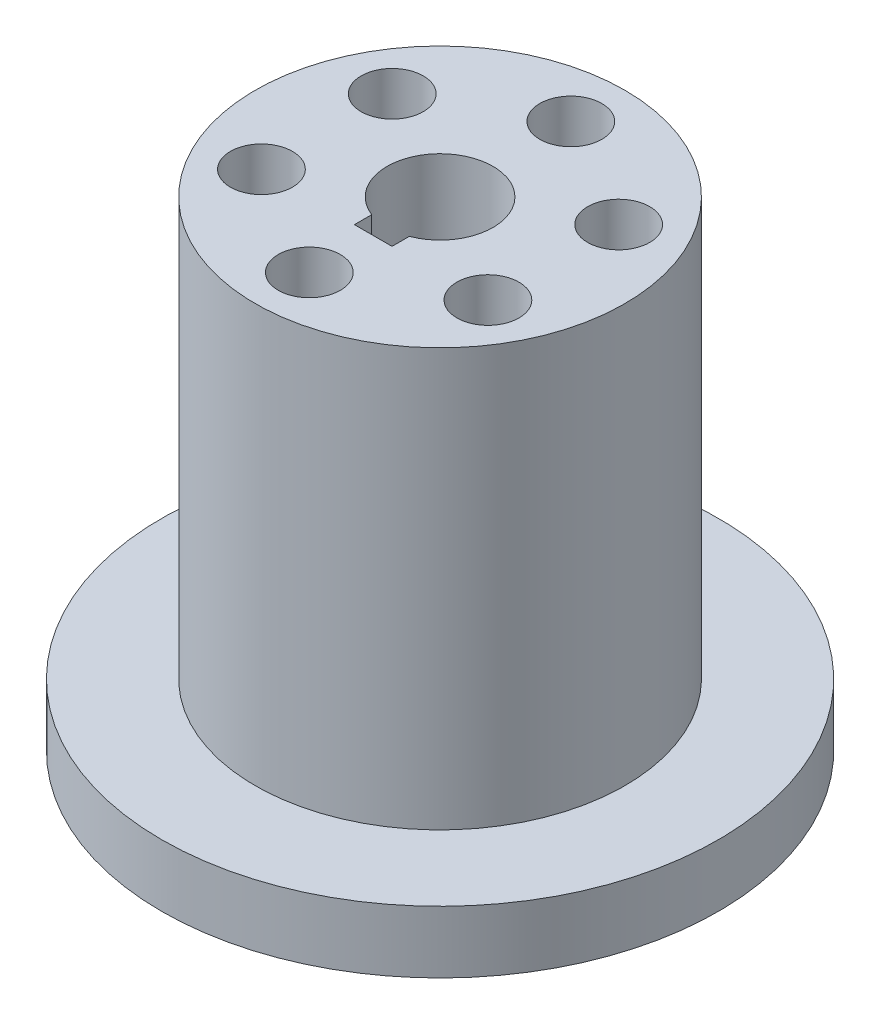
from build123d import *

# Parameters (mm, degrees)
SKETCH1_R           = 38.1
BOSS_EXTRUDE1_DEPTH = 8.5
SKETCH2_R           = 25.3
BOSS_EXTRUDE2_DEPTH = 57.15
SKETCH3_R           = 4.25
CUT_EXTRUDE1_DEPTH  = 78.54
SKETCH4_R           = 6.75
CUT_EXTRUDE2_DEPTH  = 8
CUT_EXTRUDE3_DEPTH  = 91


with BuildPart() as part:
    # Sketch1 → Boss-Extrude1 (new body)
    with BuildSketch(Plane(origin=(0, 0, 0), x_dir=(1, 0, 0), z_dir=(0, 1, 0))):
        Circle(SKETCH1_R)
    extrude(amount=BOSS_EXTRUDE1_DEPTH)

    # Sketch2 → Boss-Extrude2 (add)
    with BuildSketch(Plane(origin=(0, 8.5, 0), x_dir=(1, 0, 0), z_dir=(0, 1, 0))):
        Circle(SKETCH2_R)
    extrude(amount=BOSS_EXTRUDE2_DEPTH)

    # Sketch3 → Cut-Extrude1 (cut)
    with BuildSketch(Plane(origin=(0, 65.65, 0), x_dir=(1, 0, 0), z_dir=(0, 1, 0))):
        with Locations((0, 17.897858345)):
            Circle(SKETCH3_R)
        with Locations((-15.5, 8.948929172)):
            Circle(SKETCH3_R)
        with Locations((15.5, 8.948929172)):
            Circle(SKETCH3_R)
        with Locations((-15.5, -8.948929172)):
            Circle(SKETCH3_R)
        with Locations((15.5, -8.948929172)):
            Circle(SKETCH3_R)
        with Locations((0, -17.897858345)):
            Circle(SKETCH3_R)
    extrude(amount=-CUT_EXTRUDE1_DEPTH, mode=Mode.SUBTRACT)

    # Sketch4 → Cut-Extrude2 (cut)
    with BuildSketch(Plane.XZ):
        with Locations((-15.5, 8.948929172)):
            Circle(SKETCH4_R)
        with Locations((0, 17.897858345)):
            Circle(SKETCH4_R)
        with Locations((15.5, 8.948929172)):
            Circle(SKETCH4_R)
        with Locations((15.5, -8.948929172)):
            Circle(SKETCH4_R)
        with Locations((0, -17.897858345)):
            Circle(SKETCH4_R)
        with Locations((-15.5, -8.948929172)):
            Circle(SKETCH4_R)
    extrude(amount=-CUT_EXTRUDE2_DEPTH, mode=Mode.SUBTRACT)

    # Sketch5 → Cut-Extrude3 (cut)
    with BuildSketch(Plane.XZ):
        with BuildLine():
            Line((2.575, 9.15), (-2.575, 9.15))
            Line((-2.575, 9.15), (-2.575, 6.777305881))
            ThreePointArc((-2.575, 6.777305881), (0, -7.25), (2.575, 6.777305881))
            Line((2.575, 6.777305881), (2.575, 9.15))
        make_face()
    extrude(amount=-CUT_EXTRUDE3_DEPTH, mode=Mode.SUBTRACT)


solid = part.part
